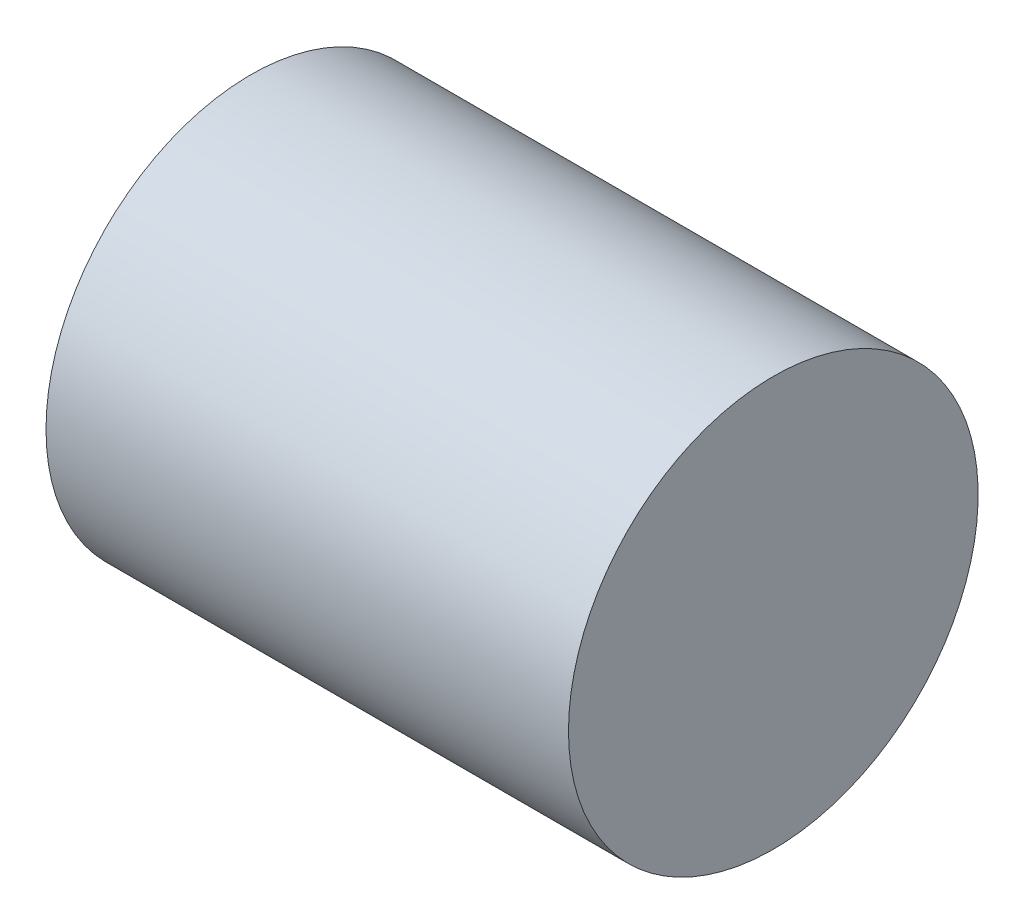
from build123d import *

# Parameters (mm, degrees)
SKETCH1_R           = 15.681534634
BOSS_EXTRUDE1_DEPTH = 40


with BuildPart() as part:
    # Sketch1 → Boss-Extrude1 (new body)
    with BuildSketch(Plane.ZY.offset(22)):
        with Locations((-16.489514037, 98.781248752)):
            Circle(SKETCH1_R)
    extrude(amount=BOSS_EXTRUDE1_DEPTH)


solid = part.part
